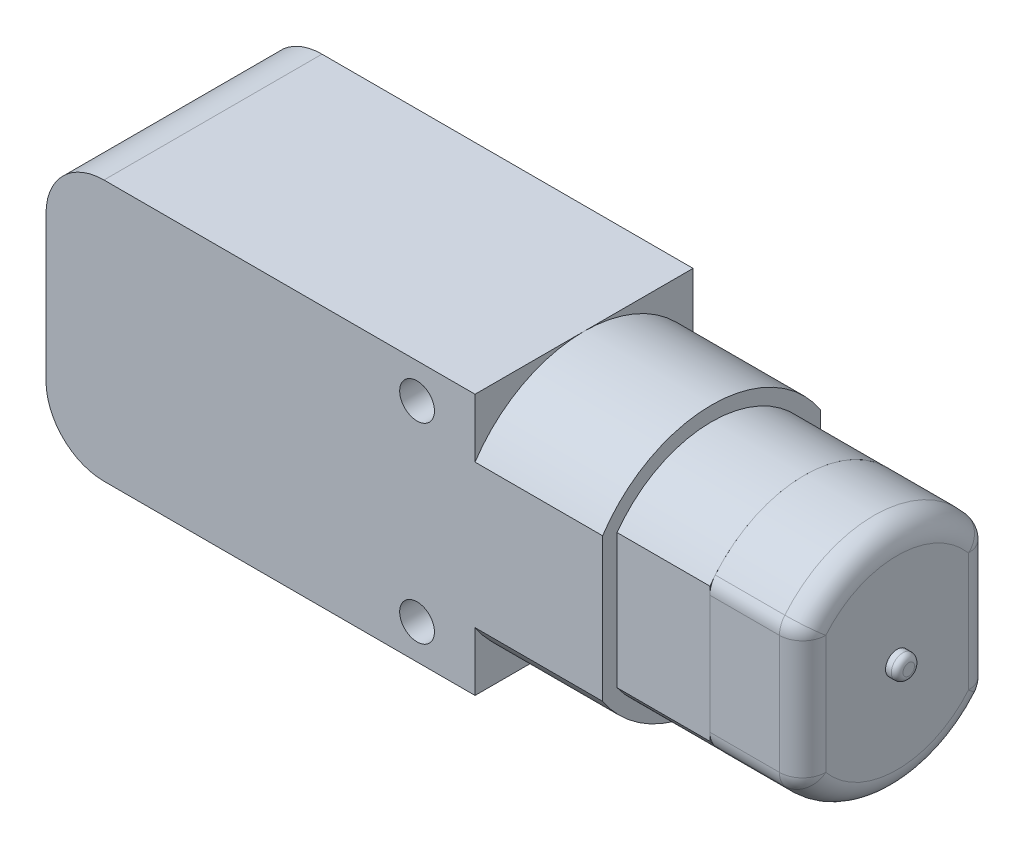
from build123d import *

# Parameters (mm, degrees)
YELLOW_BODY_DEPTH  = 9.4
SKETCH8_W          = 5.3
SKETCH8_H          = 5
SKETCH8_R          = 1.5
LUG_DEPTH          = 1.25
HOLES_REACH        = 35.771
SKETCH9_R          = 1.5
MOTOR_SOCKET_DEPTH = 11
SHELL1_START       = -6.3
SHELL1_OUTLINE_W   = 20
SHELL1_OUTLINE_H   = 16.3
SHELL1_DEPTH       = 24.25
SHELL1_START_2     = 23.45
SHELL1_2_DEPTH     = 13.25
SHELL1_3_DEPTH     = 1
SHELL1_START_3     = -8.15
SHELL1_4_DEPTH     = 16.3
MOTOR_BODY_DEPTH   = 8
MOTOR_END_DEPTH    = 8
FILLET1_R          = 2
SKETCH5_R          = 1
MOTOR_SHAFT_DEPTH  = 1
FILLET2_R          = 0.5


with BuildPart() as part:
    # Sketch1 → Yellow Body (new, symmetric)
    with BuildSketch(Plane.XY):
        with BuildLine():
            Line((-6.3, -11.25), (25.7, -11.25))
            Line((25.7, -11.25), (25.7, 11.25))
            Line((25.7, 11.25), (-6.3, 11.25))
            ThreePointArc((-6.3, 11.25), (-9.835534, 9.785534), (-11.3, 6.25))
            Line((-11.3, 6.25), (-11.3, -6.25))
            ThreePointArc((-11.3, -6.25), (-9.835534, -9.785534), (-6.3, -11.25))
        make_face()
    extrude(amount=YELLOW_BODY_DEPTH, both=True)

    # Sketch8 → Lug (add, symmetric)
    with BuildSketch(Plane.XY):
        with Locations((-13.95, 0)):
            Rectangle(SKETCH8_W, SKETCH8_H)
        with Locations((-14, 0)):
            Circle(SKETCH8_R, mode=Mode.SUBTRACT)
    extrude(amount=LUG_DEPTH, both=True)

    # Sketch9 → Holes (cut, up to next)
    with BuildSketch(Plane.XY.offset(9.4), mode=Mode.PRIVATE) as holes_sk1:
        with Locations((20.7, -8.25)):
            Circle(SKETCH9_R)
    holes_tool1 = extrude(holes_sk1.sketch, amount=-HOLES_REACH, mode=Mode.PRIVATE) & part.part
    # Sketch9 → Holes (cut, up to next)
    with BuildSketch(Plane.XY.offset(9.4), mode=Mode.PRIVATE) as holes_sk2:
        with Locations(Location((20.7, 8.25, 0), (0, 0, 180))):
            Circle(SKETCH9_R)
    holes_tool2 = extrude(holes_sk2.sketch, amount=-HOLES_REACH, mode=Mode.PRIVATE) & part.part
    add(holes_tool1.solids().sort_by_distance((20.7, -8.25, 9.4))[0], mode=Mode.SUBTRACT)
    add(holes_tool2.solids().sort_by_distance((20.7, 8.25, 9.4))[0], mode=Mode.SUBTRACT)

    # Sketch2 → Motor Socket (add)
    with BuildSketch(Plane(origin=(25.7, 0, 0), x_dir=(0, 0, -1), z_dir=(1, 0, 0))):
        with BuildLine():
            Line((9.4, -6.180817), (9.4, 6.180817))
            ThreePointArc((9.4, 6.180817), (0, 11.25), (-9.4, 6.180817))
            Line((-9.4, 6.180817), (-9.4, -6.180817))
            ThreePointArc((-9.4, -6.180817), (0, -11.25), (9.4, -6.180817))
        make_face()
    extrude(amount=MOTOR_SOCKET_DEPTH)

    # Shell1: read off the stored shape, not the designer's step
    # Shell1 outline → Shell1 (cut)
    with BuildSketch(Plane.YZ.offset(SHELL1_START)):
        Rectangle(SHELL1_OUTLINE_W, SHELL1_OUTLINE_H)
    extrude(amount=SHELL1_DEPTH, mode=Mode.SUBTRACT)

    # Shell1 2 outline → Shell1 2 (cut)
    with BuildSketch(Plane.YZ.offset(SHELL1_START_2)):
        with BuildLine():
            ThreePointArc((-5.79461, 8.15), (-10, 0), (-5.79461, -8.15))
            Line((-5.79461, -8.15), (5.79461, -8.15))
            ThreePointArc((5.79461, -8.15), (10, 0), (5.79461, 8.15))
            Line((5.79461, 8.15), (-5.79461, 8.15))
        make_face()
    extrude(amount=SHELL1_2_DEPTH, mode=Mode.SUBTRACT)

    # Shell1 3 outline → Shell1 3 (cut)
    with BuildSketch(Plane.YZ.offset(SHELL1_START_2)):
        with BuildLine():
            Line((-10, 0), (-10, -8.15))
            Line((-10, -8.15), (-5.79461, -8.15))
            ThreePointArc((-5.79461, -8.15), (-8.886678, -4.585515), (-10, 0))
        make_face()
        with BuildLine():
            Line((-10, 8.15), (-10, 0))
            ThreePointArc((-10, 0), (-8.886678, 4.585515), (-5.79461, 8.15))
            Line((-5.79461, 8.15), (-10, 8.15))
        make_face()
        with BuildLine():
            ThreePointArc((10, 0), (8.886678, -4.585515), (5.79461, -8.15))
            Line((5.79461, -8.15), (10, -8.15))
            Line((10, -8.15), (10, 0))
        make_face()
        with BuildLine():
            Line((10, 8.15), (5.79461, 8.15))
            ThreePointArc((5.79461, 8.15), (8.886678, 4.585515), (10, 0))
            Line((10, 0), (10, 8.15))
        make_face()
    extrude(amount=SHELL1_3_DEPTH, mode=Mode.SUBTRACT)

    # Shell1 4 outline → Shell1 4 (cut)
    with BuildSketch(Plane.XY.offset(SHELL1_START_3)):
        with BuildLine():
            ThreePointArc((22.82132, 10), (23.288062, 9.17975), (23.45, 8.25))
            Line((23.45, 8.25), (23.45, 10))
            Line((23.45, 10), (22.82132, 10))
        make_face()
        with BuildLine():
            ThreePointArc((17.95, -8.25), (20.7, -5.5), (23.45, -8.25))
            Line((23.45, -8.25), (23.45, 8.25))
            ThreePointArc((23.45, 8.25), (20.7, 5.5), (17.95, 8.25))
            Line((17.95, 8.25), (17.95, -8.25))
        make_face()
        with BuildLine():
            Line((22.82132, -10), (23.45, -10))
            Line((23.45, -10), (23.45, -8.25))
            ThreePointArc((23.45, -8.25), (23.288062, -9.17975), (22.82132, -10))
        make_face()
        with BuildLine():
            ThreePointArc((18.57868, -10), (18.111938, -9.17975), (17.95, -8.25))
            Line((17.95, -8.25), (17.95, -10))
            Line((17.95, -10), (18.57868, -10))
        make_face()
        with BuildLine():
            Line((17.95, 10), (17.95, 8.25))
            ThreePointArc((17.95, 8.25), (18.111938, 9.17975), (18.57868, 10))
            Line((18.57868, 10), (17.95, 10))
        make_face()
        with BuildLine():
            ThreePointArc((-10.05, -6.25), (-8.95165, -8.90165), (-6.3, -10))
            Line((-6.3, -10), (-6.3, 10))
            ThreePointArc((-6.3, 10), (-8.95165, 8.90165), (-10.05, 6.25))
            Line((-10.05, 6.25), (-10.05, -6.25))
        make_face()
    extrude(amount=SHELL1_4_DEPTH, mode=Mode.SUBTRACT)


with BuildPart() as body_2:
    # Sketch3 → Motor Body (new body)
    with BuildSketch(Plane(origin=(36.7, 0, 0), x_dir=(0, 0, -1), z_dir=(1, 0, 0))):
        with BuildLine():
            Line((-8.15, 5.79461), (-8.15, -5.79461))
            ThreePointArc((-8.15, -5.79461), (0, -10), (8.15, -5.79461))
            Line((8.15, -5.79461), (8.15, 5.79461))
            ThreePointArc((8.15, 5.79461), (0, 10), (-8.15, 5.79461))
        make_face()
        with BuildLine():
            Line((-7.65, 5.632717), (-7.65, -5.632717))
            ThreePointArc((-7.65, -5.632717), (0, -9.5), (7.65, -5.632717))
            Line((7.65, -5.632717), (7.65, 5.632717))
            ThreePointArc((7.65, 5.632717), (0, 9.5), (-7.65, 5.632717))
        make_face(mode=Mode.SUBTRACT)
    extrude(amount=MOTOR_BODY_DEPTH)


with BuildPart() as body_3:
    # Sketch4 → Motor End (new body)
    with BuildSketch(Plane(origin=(44.7, 0, 0), x_dir=(0, 0, -1), z_dir=(1, 0, 0))):
        with BuildLine():
            Line((8.15, -5.79461), (8.15, 5.79461))
            ThreePointArc((8.15, 5.79461), (0, 10), (-8.15, 5.79461))
            Line((-8.15, 5.79461), (-8.15, -5.79461))
            ThreePointArc((-8.15, -5.79461), (0, -10), (8.15, -5.79461))
        make_face()
    extrude(amount=MOTOR_END_DEPTH)

    # Fillet1
    fillet1_edges = [body_3.edges().sort_by_distance(p)[0] for p in [
        (52.7, 10, 0),
        (52.7, 0, 8.15),
        (52.7, -10, 0),
        (52.7, 0, -8.15),
        (48.7, -5.79461, 8.15),
        (48.7, 5.79461, 8.15),
        (48.7, 5.79461, -8.15),
        (48.7, -5.79461, -8.15),
    ]]
    fillet(fillet1_edges, radius=FILLET1_R)


with BuildPart() as body_4:
    # Sketch5 → Motor Shaft (new body)
    with BuildSketch(Plane(origin=(52.7, 0, 0), x_dir=(0, 0, -1), z_dir=(1, 0, 0))):
        Circle(SKETCH5_R)
    extrude(amount=MOTOR_SHAFT_DEPTH)

    # Fillet2
    fillet2_edges = [body_4.edges().sort_by_distance(p)[0] for p in [
        (53.7, 0, 1),
    ]]
    fillet(fillet2_edges, radius=FILLET2_R)


solid = Compound([part.part, body_2.part, body_3.part, body_4.part])
